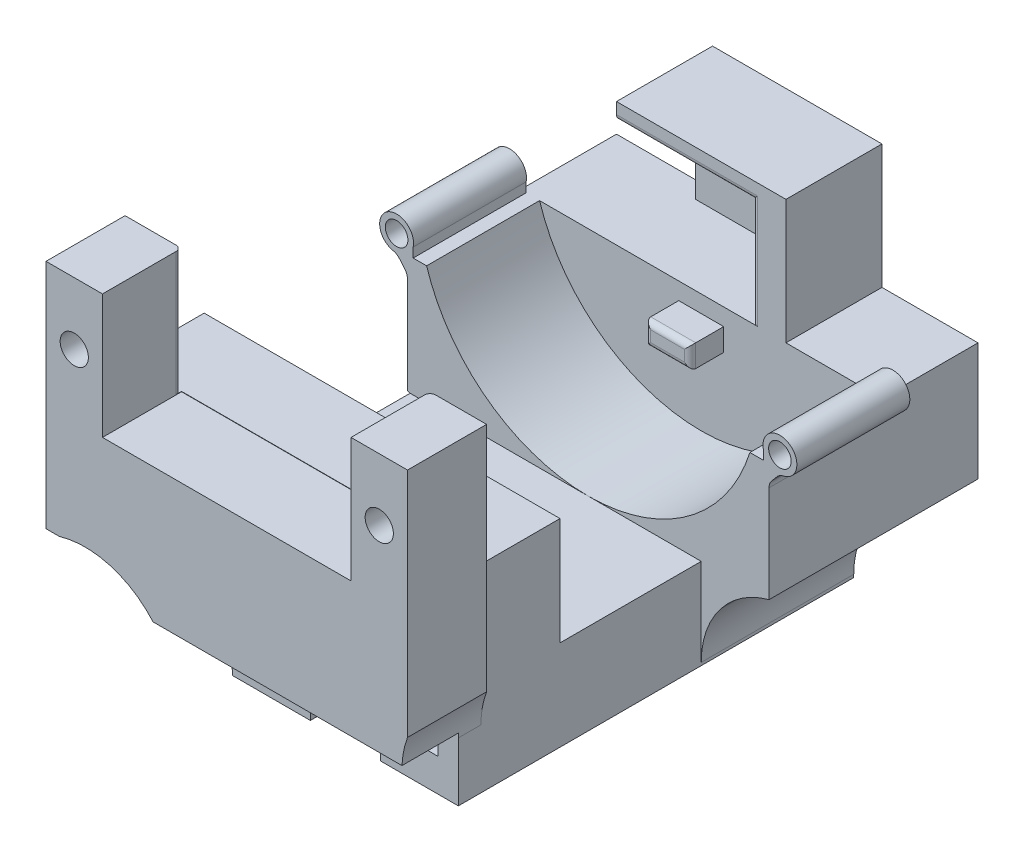
from build123d import *

# Parameters (mm, degrees)
BOSS_EXTRUDE1_DEPTH = 45
SKETCH2_R           = 1.25
BOSS_EXTRUDE2_DEPTH = 7
FILLET1_R           = 8
BOSS_EXTRUDE3_DEPTH = 8.5
SKETCH7_W           = 12
SKETCH7_H           = 9.5
CUT_EXTRUDE1_DEPTH  = 7
BOSS_EXTRUDE4_DEPTH = 10
SKETCH9_W           = 3.98
SKETCH9_H           = 1.98
BOSS_EXTRUDE5_DEPTH = 2.98
SKETCH11_W          = 31.5
SKETCH11_H          = 9.530048311
BOSS_EXTRUDE6_DEPTH = 7
SKETCH16_R          = 1
BOSS_EXTRUDE7_DEPTH = 10
FILLET2_R           = 1
FILLET4_R           = 0.5
FILLET5_R           = 0.5
FILLET6_R           = 0.5
FILLET7_R           = 8
FILLET8_DEPTH       = 18.5
FILLET8_START       = 18.5
FILLET8_2_DEPTH     = 26.5
SKETCH17_R          = 8
CUT_EXTRUDE2_DEPTH  = 57.192438403
SKETCH18_W          = 26.905399266
SKETCH18_H          = 5.924124609
CUT_EXTRUDE3_DEPTH  = 5
SKETCH19_W          = 27.645914842
SKETCH19_H          = 7.775413549
CUT_EXTRUDE4_DEPTH  = 5


with BuildPart() as part:
    # Sketch1 → Boss-Extrude1 (new body)
    with BuildSketch(Plane.XY):
        Polygon((-6.049640288, 0), (-0.949640288, 0), (-0.949640288, -2.9), (-7.849640288, -2.9), (-7.849640288, 5.1), (12.150359712, 5.1), (12.150359712, -2.9), (5.250359712, -2.9), (5.250359712, 0), (10.350359712, 0), (10.350359712, 2.6), (-6.049640288, 2.6), align=None)
    extrude(amount=BOSS_EXTRUDE1_DEPTH)

    # Sketch2 → Boss-Extrude2 (add)
    with BuildSketch(Plane.XY.offset(45)):
        Polygon((-19.349640288, 25.6), (-19.349640288, 5.1), (12.650359712, 5.1), (12.650359712, 25.6), (7.650359712, 25.6), (7.650359712, 14.6), (-14.349640288, 14.6), (-14.349640288, 25.6), align=None)
        with Locations((10.150359712, 20.1)):
            Circle(SKETCH2_R, mode=Mode.SUBTRACT)
        with Locations((-16.849640288, 20.1)):
            Circle(SKETCH2_R, mode=Mode.SUBTRACT)
    extrude(amount=-BOSS_EXTRUDE2_DEPTH)

    # Fillet1
    # the kernel refuses this fillet: 8 mm, written as the material it adds along each edge
    with BuildSketch(Plane(origin=(-7.849640288, 5.1, 38), x_dir=(0, -1, 0), z_dir=(0, 0, 1))) as fillet1_piece_1:
        with BuildLine():
            CenterArc((FILLET1_R, -FILLET1_R), FILLET1_R, 90, 90)
            Line((0, -FILLET1_R), (0, 0))
            Line((0, 0), (FILLET1_R, 0))
        make_face()
    extrude(amount=7)
    with BuildSketch(Plane(origin=(12.150359712, 5.1, 38), x_dir=(0, -1, 0), z_dir=(0, 0, 1))) as fillet1_piece_2:
        with BuildLine():
            CenterArc((2.783882181, 8), FILLET1_R, 249.635865194, 20.364134806)
            Line((0, 0.5), (0, 0))
            Line((0, 0), (2.783882181, 0))
        make_face()
    extrude(amount=7)

    # Sketch4 → Boss-Extrude3 (add)
    with BuildSketch(Plane(origin=(0, 0, 0), x_dir=(-1, 0, 0), z_dir=(0, 0, -1))):
        Polygon((-18.150359712, 15.6), (-18.150359712, 5.1), (13.849640288, 5.1), (13.849640288, 15.6), (5.349640288, 15.6), (5.349640288, 26.6), (-9.650359712, 26.6), (-9.650359712, 15.6), align=None)
    extrude(amount=-BOSS_EXTRUDE3_DEPTH)

    # Sketch7 → Cut-Extrude1 (cut)
    with BuildSketch(Plane.XY.offset(8.5)):
        with Locations((0.650359712, 20.35)):
            Rectangle(SKETCH7_W, SKETCH7_H)
    extrude(amount=-CUT_EXTRUDE1_DEPTH, mode=Mode.SUBTRACT)

    # Sketch8 → Boss-Extrude4 (add)
    with BuildSketch(Plane.XY.offset(8.5)):
        with BuildLine():
            Line((-13.849640288, 15.6), (-12.158728309, 15.6))
            ThreePointArc((-12.158728309, 15.6), (2.150359712, 5.1), (16.459447733, 15.6))
            Line((16.459447733, 15.6), (18.150359712, 15.6))
            Line((18.150359712, 15.6), (18.150359712, 3.937972429))
            Line((18.150359712, 3.937972429), (-13.849640288, 3.937972429))
            Line((-13.849640288, 3.937972429), (-13.849640288, 15.6))
        make_face()
    extrude(amount=BOSS_EXTRUDE4_DEPTH)

    # Sketch9 → Boss-Extrude5 (add)
    with BuildSketch(Plane.XY.offset(8.5)):
        with Locations((2.150359712, 13.1)):
            Rectangle(SKETCH9_W, SKETCH9_H)
    extrude(amount=BOSS_EXTRUDE5_DEPTH)

    # Sketch11 → Boss-Extrude6 (add)
    with BuildSketch(Plane(origin=(0, 0, 38), x_dir=(-1, 0, 0), z_dir=(0, 0, -1))):
        with Locations((3.599640288, 9.865024156)):
            Rectangle(SKETCH11_W, SKETCH11_H)
    extrude(amount=BOSS_EXTRUDE6_DEPTH)

    # Sketch16 → Boss-Extrude7 (add)
    # profile 1 of 2: a face of its own
    with BuildSketch(Plane.XY.offset(18.5)):
        with BuildLine():
            Line((-13.346805139, 15.601949196), (-13.846805139, 15.601949196))
            Line((-13.846805139, 15.601949196), (-13.849640288, 14.1))
            Line((-13.849640288, 14.1), (-14.815015575, 15.247623037))
            ThreePointArc((-14.815015575, 15.247623037), (-15.7608574, 17.911832315), (-13.346805139, 16.44044538))
            Line((-13.346805139, 16.44044538), (-13.346805139, 15.601949196))
        make_face()
        with Locations((-14.815015575, 16.747623037)):
            Circle(SKETCH16_R, mode=Mode.SUBTRACT)
    # profile 2 of 2: a face of its own
    with BuildSketch(Plane.XY.offset(18.5)):
        with BuildLine():
            Line((17.652000257, 15.6), (18.150359712, 15.6))
            Line((18.150359712, 15.6), (18.150359712, 14.1))
            Line((18.150359712, 14.1), (19.116258964, 15.247623037))
            ThreePointArc((19.116258964, 15.247623037), (20.054810716, 17.91771731), (17.652000257, 16.422128892))
            Line((17.652000257, 16.422128892), (17.652000257, 15.6))
        make_face()
        with Locations((19.116258964, 16.747623037)):
            Circle(SKETCH16_R, mode=Mode.SUBTRACT)
    extrude(amount=-BOSS_EXTRUDE7_DEPTH)

    # Fillet2
    fillet2_edges = [part.edges().sort_by_distance(p)[0] for p in [
        (-13.849640288, 14.1, 13.5),
        (-14.815015575, 15.247623037, 13.5),
        (19.116258964, 15.247623037, 13.5),
        (18.150359712, 14.1, 13.5),
    ]]
    fillet(fillet2_edges, radius=FILLET2_R)

    # Fillet4
    fillet4_edges = [part.edges().sort_by_distance(p)[0] for p in [
        (0.160359712, 13.1, 11.48),
        (2.150359712, 12.11, 11.48),
        (4.140359712, 13.1, 11.48),
        (2.150359712, 14.09, 11.48),
    ]]
    fillet(fillet4_edges, radius=FILLET4_R)

    # Fillet5
    fillet5_edges = [part.edges().sort_by_distance(p)[0] for p in [
        (6.650359712, 20.35, 8.5),
        (0.650359712, 25.1, 8.5),
    ]]
    fillet(fillet5_edges, radius=FILLET5_R)

    # Fillet6
    fillet6_edges = [part.edges().sort_by_distance(p)[0] for p in [
        (-14.349640288, 20.115024155, 38),
        (7.650359712, 20.115024155, 38),
    ]]
    fillet(fillet6_edges, radius=FILLET6_R)

    # Fillet7
    fillet7_edges = [part.edges().sort_by_distance(p)[0] for p in [
        (-7.849640288, 5.1, 34.5),
    ]]
    fillet(fillet7_edges, radius=FILLET7_R - 0.0001)  # a hair under: the kernel refuses the full size

    # Fillet8: read off the stored shape, not the designer's step
    # Fillet8 outline → Fillet8 (add)
    with BuildSketch(Plane.XY):
        with BuildLine():
            Line((18.150359712, 5.1), (12.150359712, 5.1))
            Line((12.150359712, 5.1), (12.150359712, -2.645966692))
            ThreePointArc((12.150359712, -2.645966692), (13.825804392, 2.253012793), (18.150359712, 5.1))
        make_face()
        with BuildLine():
            Line((-7.849640288, 5.1), (-13.849640288, 5.1))
            ThreePointArc((-13.849640288, 5.1), (-9.525084967, 2.253012794), (-7.849640288, -2.645966692))
            Line((-7.849640288, -2.645966692), (-7.849640288, 5.1))
        make_face()
    extrude(amount=FILLET8_DEPTH)

    # Fillet8 2 outline → Fillet8 2 (add)
    with BuildSketch(Plane.XY.offset(FILLET8_START)):
        with BuildLine():
            Line((-7.849640288, 5.1), (-13.849640288, 5.1))
            ThreePointArc((-13.849640288, 5.1), (-9.525084967, 2.253012794), (-7.849640288, -2.645966692))
            Line((-7.849640288, -2.645966692), (-7.849640288, 5.1))
        make_face()
    extrude(amount=FILLET8_2_DEPTH)

    # Sketch17 → Cut-Extrude2 (cut, through all)
    with BuildSketch(Plane.XY.offset(45)):
        with Locations((-15.895053234, -2.569483857)):
            Circle(SKETCH17_R)
        with Locations((20.210973801, -2.569483857)):
            Circle(SKETCH17_R)
    extrude(amount=-CUT_EXTRUDE2_DEPTH, mode=Mode.SUBTRACT)

    # Sketch18 → Cut-Extrude3 (cut)
    with BuildSketch(Plane.XY.offset(45)):
        with Locations((1.903783169, -0.265657621)):
            Rectangle(SKETCH18_W, SKETCH18_H)
    extrude(amount=-CUT_EXTRUDE3_DEPTH, mode=Mode.SUBTRACT)

    # Sketch19 → Cut-Extrude4 (cut)
    with BuildSketch(Plane(origin=(0, 0, 0), x_dir=(-1, 0, 0), z_dir=(0, 0, -1))):
        with Locations((-1.944922923, -1.314721353)):
            Rectangle(SKETCH19_W, SKETCH19_H)
    extrude(amount=-CUT_EXTRUDE4_DEPTH, mode=Mode.SUBTRACT)


solid = part.part
